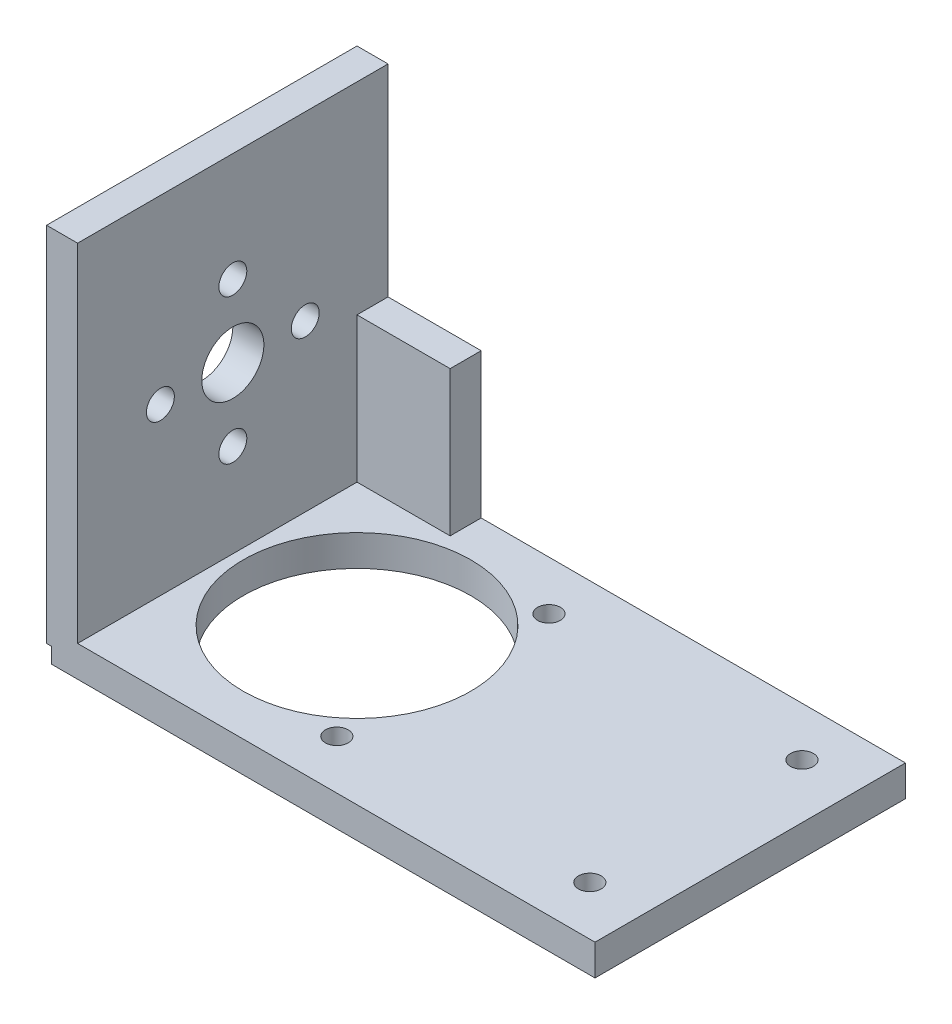
from build123d import *

# Parameters (mm, degrees)
S_BOX1_W      = 3
S_BOX1_H      = 35
BOSS_1_DEPTH  = 30
S_BOX2_W      = 52.5
S_BOX2_H      = 3
BOSS_2_DEPTH  = 30
S_BOX3_W      = 11.5
S_BOX3_H      = 16.5
BOSS_3_DEPTH  = 3
S_HOLE4_R     = 3
HOLE_4_DEPTH  = 3.2
S_HOLE5_R     = 1.35
HOLE_5_DEPTH  = 3.2
S_HOLE6_R     = 1.35
HOLE_6_DEPTH  = 3.2
S_HOLE7_R     = 1.35
HOLE_7_DEPTH  = 3.2
S_HOLE8_R     = 1.35
HOLE_8_DEPTH  = 3.2
S_HOLE9_R     = 11
HOLE_9_DEPTH  = 3.2
S_HOLE10_R    = 1.1
HOLE_10_DEPTH = 3.2
S_HOLE11_R    = 1.1
HOLE_11_DEPTH = 3.2
S_HOLE12_R    = 1.1
HOLE_12_DEPTH = 3.2
S_HOLE13_R    = 1.1
HOLE_13_DEPTH = 3.2


with BuildPart() as part:
    # S_box1 → Boss_1 (new body)
    with BuildSketch(Plane.XY.offset(-15)):
        with Locations((-13.5, 0)):
            Rectangle(S_BOX1_W, S_BOX1_H)
    extrude(amount=BOSS_1_DEPTH)

    # S_box2 → Boss_2 (add)
    with BuildSketch(Plane.XY.offset(-15)):
        with Locations((11.75, -17.5)):
            Rectangle(S_BOX2_W, S_BOX2_H)
    extrude(amount=BOSS_2_DEPTH)

    # S_box3 → Boss_3 (add)
    with BuildSketch(Plane.XY.offset(-15)):
        with Locations((-8.75, -10.25)):
            Rectangle(S_BOX3_W, S_BOX3_H)
    extrude(amount=BOSS_3_DEPTH)

    # S_hole4 → Hole_4 (cut)
    with BuildSketch(Plane(origin=(-15.1, 0, 0), x_dir=(0, 0, -1), z_dir=(1, 0, 0))):
        Circle(S_HOLE4_R)
    extrude(amount=HOLE_4_DEPTH, mode=Mode.SUBTRACT)

    # S_hole5 → Hole_5 (cut)
    with BuildSketch(Plane(origin=(-15.1, 0, 0), x_dir=(0, 0, -1), z_dir=(1, 0, 0))):
        with Locations((0, 7)):
            Circle(S_HOLE5_R)
    extrude(amount=HOLE_5_DEPTH, mode=Mode.SUBTRACT)

    # S_hole6 → Hole_6 (cut)
    with BuildSketch(Plane(origin=(-15.1, 0, 0), x_dir=(0, 0, -1), z_dir=(1, 0, 0))):
        with Locations((-7, 0)):
            Circle(S_HOLE6_R)
    extrude(amount=HOLE_6_DEPTH, mode=Mode.SUBTRACT)

    # S_hole7 → Hole_7 (cut)
    with BuildSketch(Plane(origin=(-15.1, 0, 0), x_dir=(0, 0, -1), z_dir=(1, 0, 0))):
        with Locations((0, -7)):
            Circle(S_HOLE7_R)
    extrude(amount=HOLE_7_DEPTH, mode=Mode.SUBTRACT)

    # S_hole8 → Hole_8 (cut)
    with BuildSketch(Plane(origin=(-15.1, 0, 0), x_dir=(0, 0, -1), z_dir=(1, 0, 0))):
        with Locations((7, 0)):
            Circle(S_HOLE8_R)
    extrude(amount=HOLE_8_DEPTH, mode=Mode.SUBTRACT)

    # S_hole9 → Hole_9 (cut)
    with BuildSketch(Plane(origin=(0, -19.1, 0), x_dir=(1, 0, 0), z_dir=(0, 1, 0))):
        Circle(S_HOLE9_R)
    extrude(amount=HOLE_9_DEPTH, mode=Mode.SUBTRACT)

    # S_hole10 → Hole_10 (cut)
    with BuildSketch(Plane(origin=(0, -19.1, 0), x_dir=(1, 0, 0), z_dir=(0, 1, 0))):
        with Locations((8.3, 10.25)):
            Circle(S_HOLE10_R)
    extrude(amount=HOLE_10_DEPTH, mode=Mode.SUBTRACT)

    # S_hole11 → Hole_11 (cut)
    with BuildSketch(Plane(origin=(0, -19.1, 0), x_dir=(1, 0, 0), z_dir=(0, 1, 0))):
        with Locations((8.3, -10.25)):
            Circle(S_HOLE11_R)
    extrude(amount=HOLE_11_DEPTH, mode=Mode.SUBTRACT)

    # S_hole12 → Hole_12 (cut)
    with BuildSketch(Plane(origin=(0, -19.1, 0), x_dir=(1, 0, 0), z_dir=(0, 1, 0))):
        with Locations((32.75, 10.25)):
            Circle(S_HOLE12_R)
    extrude(amount=HOLE_12_DEPTH, mode=Mode.SUBTRACT)

    # S_hole13 → Hole_13 (cut)
    with BuildSketch(Plane(origin=(0, -19.1, 0), x_dir=(1, 0, 0), z_dir=(0, 1, 0))):
        with Locations((32.75, -10.25)):
            Circle(S_HOLE13_R)
    extrude(amount=HOLE_13_DEPTH, mode=Mode.SUBTRACT)


solid = part.part
